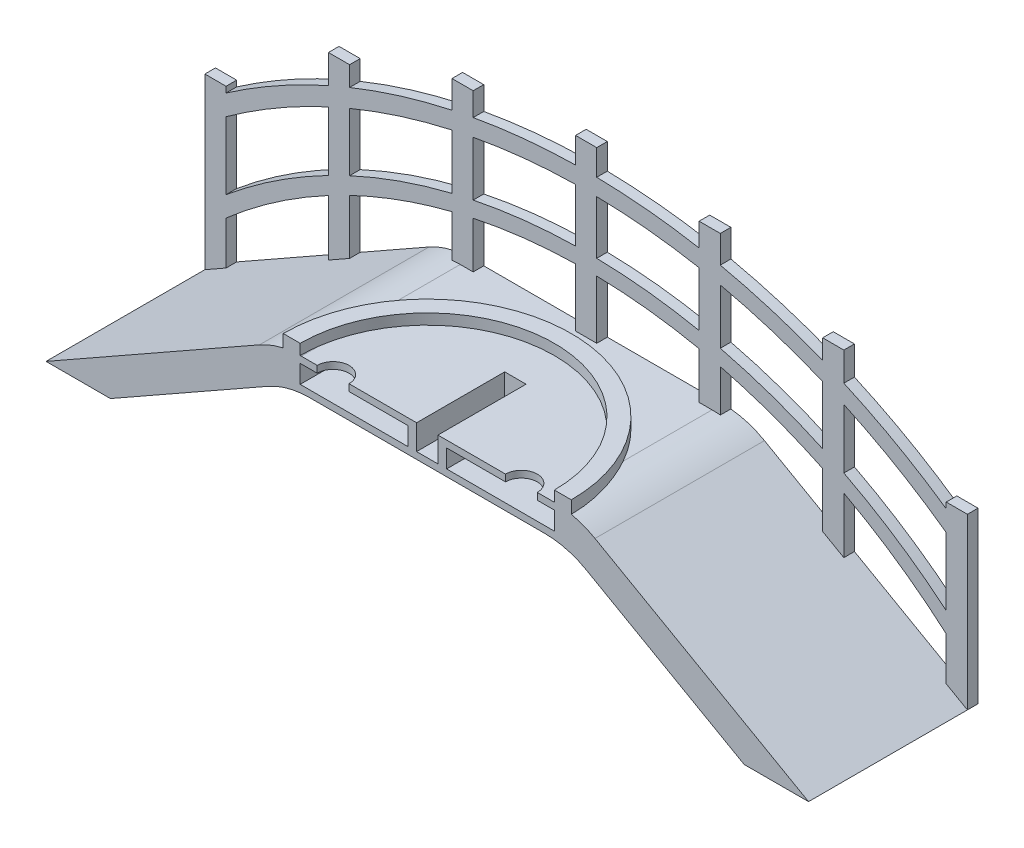
from build123d import *

# Parameters (mm, degrees)
BOSS_EXTRUDE1_DEPTH      = 12.7
BOSS_EXTRUDE2_DEPTH      = 0.79375
SKETCH5_7_W              = 1.5875
SKETCH5_7_H              = 15.875
SKETCH5_7_H_2            = 12.7
BOSS_EXTRUDE6_DEPTH      = 0.79375
BOSS_EXTRUDE7_DEPTH      = 0.79375
SKETCH7_W                = 19.05
SKETCH7_H                = 1.36525
CUT_EXTRUDE1_DEPTH       = 9.525
SKETCH8_W                = 1.6002
SKETCH8_H                = 6.604
CUT_EXTRUDE2_DEPTH       = 1.397
BOSS_EXTRUDE8_DEPTH      = 1.397
BOSS_EXTRUDE9_DEPTH      = 0.79375
BOSS_EXTRUDE9_DEPTH_BACK = 0.254


with BuildPart() as part:
    # Sketch5 → Boss-Extrude1 (new body)
    with BuildSketch(Plane.XY):
        with BuildLine():
            Line((4.825954128, 0), (16.633370684, 6.698280246))
            ThreePointArc((16.633370684, 6.698280246), (18.146365475, 7.314936507), (19.76662415, 7.525126915))
            Line((19.76662415, 7.525126915), (37.38337585, 7.525126915))
            ThreePointArc((37.38337585, 7.525126915), (39.003634525, 7.314936507), (40.516629316, 6.698280246))
            Line((40.516629316, 6.698280246), (52.324045872, 0))
            Line((52.324045872, 0), (57.15, 0))
            Line((57.15, 0), (41.145026812, 9.079530246))
            ThreePointArc((41.145026812, 9.079530246), (39.632032021, 9.696186507), (38.011773345, 9.906376915))
            Line((38.011773345, 9.906376915), (19.138226655, 9.906376915))
            ThreePointArc((19.138226655, 9.906376915), (17.517967979, 9.696186507), (16.004973188, 9.079530246))
            Line((16.004973188, 9.079530246), (0, 0))
            Line((0, 0), (4.825954128, 0))
        make_face()
    extrude(amount=BOSS_EXTRUDE1_DEPTH)



with BuildPart() as body_2:
    # Sketch5<4> → Boss-Extrude2 (new body)
    with BuildSketch(Plane.XY):
        with BuildLine():
            Line((0, 11.1125), (0, 9.525))
            ThreePointArc((0, 9.525), (28.575, 19.431376915), (57.15, 9.525))
            Line((57.15, 9.525), (57.15, 11.1125))
            ThreePointArc((57.15, 11.1125), (28.575, 20.68840641), (0, 11.1125))
        make_face()
    extrude(amount=BOSS_EXTRUDE2_DEPTH)

    # Sketch5<7> → Boss-Extrude6 (add)
    with BuildSketch(Plane.XY):
        with Locations((10.054166667, 10.790876356)):
            Rectangle(SKETCH5_7_W, SKETCH5_7_H)
        Polygon((0, 0), (1.5875, 0.90057972), (1.5875, 12.7), (0, 12.7), align=None)
        with Locations((19.314583333, 13.730561119)):
            Rectangle(SKETCH5_7_W, SKETCH5_7_H)
        with Locations((28.575, 14.668876915)):
            Rectangle(SKETCH5_7_W, SKETCH5_7_H)
        with Locations((37.835416667, 13.730561119)):
            Rectangle(SKETCH5_7_W, SKETCH5_7_H)
        with Locations((47.095833333, 10.790876356)):
            Rectangle(SKETCH5_7_W, SKETCH5_7_H)
        with Locations((56.35625, 6.35)):
            Rectangle(SKETCH5_7_W, SKETCH5_7_H_2)
    extrude(amount=BOSS_EXTRUDE6_DEPTH)


with BuildPart() as part_1:
    add(part.part)

    add(body_2.part)  # Boss-Extrude7 merges body 2
    # Sketch6 → Boss-Extrude7 (add)
    with BuildSketch(Plane(origin=(0, 0, 0), x_dir=(-1, 0, 0), z_dir=(0, 0, -1))):
        with BuildLine():
            Line((-57.15, 4.270423014), (-57.15, 2.682923014))
            ThreePointArc((-57.15, 2.682923014), (-28.575, 14.276750754), (0, 2.682923014))
            Line((0, 2.682923014), (0, 4.270423014))
            ThreePointArc((0, 4.270423014), (-28.575, 15.429974262), (-57.15, 4.270423014))
        make_face()
    extrude(amount=-BOSS_EXTRUDE7_DEPTH)

    # Sketch7 → Cut-Extrude1 (cut)
    with BuildSketch(Plane.XY.offset(12.7)):
        with Locations((28.575, 8.715751915)):
            Rectangle(SKETCH7_W, SKETCH7_H)
    extrude(amount=-CUT_EXTRUDE1_DEPTH, mode=Mode.SUBTRACT)

    # Sketch8 → Cut-Extrude2 (cut)
    with BuildSketch(Plane(origin=(0, 9.906376915, 0), x_dir=(1, 0, 0), z_dir=(0, 1, 0))):
        with BuildLine():
            Line((20.328851655, -12.7), (22.710101655, -12.7))
            ThreePointArc((22.710101655, -12.7), (21.519476655, -11.509375), (20.328851655, -12.7))
        make_face()
        with BuildLine():
            ThreePointArc((36.821148345, -12.7), (35.630523345, -11.509375), (34.439898345, -12.7))
            Line((34.439898345, -12.7), (36.821148345, -12.7))
        make_face()
        with Locations((28.575, -9.398)):
            Rectangle(SKETCH8_W, SKETCH8_H)
    extrude(amount=-CUT_EXTRUDE2_DEPTH, mode=Mode.SUBTRACT)

    # Sketch10 → Boss-Extrude8 (add)
    with BuildSketch(Plane(origin=(0, 8.033126915, 0), x_dir=(1, 0, 0), z_dir=(0, 1, 0))):
        Polygon((29.3751, -12.7), (30.025608395, -12.7), (30.025608395, -5.496745829), (27.124391605, -5.496745829), (27.124391605, -12.7), (27.7749, -12.7), (27.7749, -6.096), (29.3751, -6.096), align=None)
    extrude(amount=BOSS_EXTRUDE8_DEPTH)

    # Sketch11 → Boss-Extrude9 (add, two sides: drawn at the far end of the back side and taken through both)
    with BuildSketch(Plane(origin=(0, 9.906376915, 0), x_dir=(1, 0, 0), z_dir=(0, 1, 0)).offset(-BOSS_EXTRUDE9_DEPTH_BACK)):
        with BuildLine():
            Line((17.78, -12.7), (19.05, -12.7))
            ThreePointArc((19.05, -12.7), (28.575, -3.175), (38.1, -12.7))
            Line((38.1, -12.7), (39.37, -12.7))
            ThreePointArc((39.37, -12.7), (28.575, -1.905), (17.78, -12.7))
        make_face()
    extrude(amount=BOSS_EXTRUDE9_DEPTH + BOSS_EXTRUDE9_DEPTH_BACK)


solid = part_1.part
